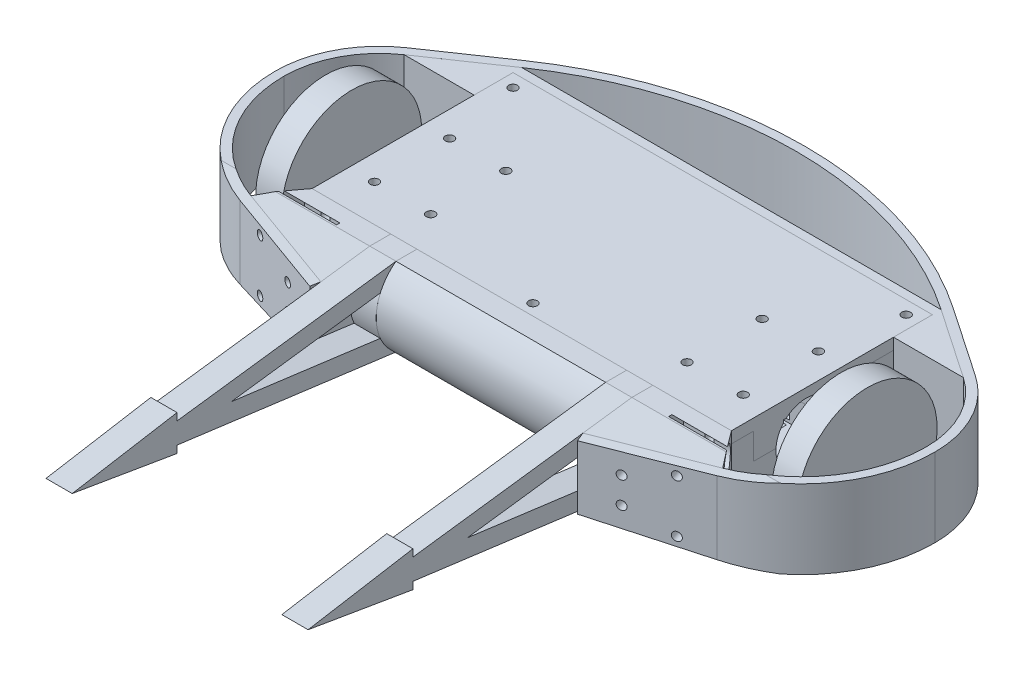
from build123d import *

# Parameters (mm, degrees)
BOSS_EXTRUDE1_DEPTH       = 76.2
BOSS_EXTRUDE1_DEPTH_BACK  = 76.2
SKETCH3_W                 = 76.2
SKETCH3_H                 = 28.575
SKETCH6_W                 = 16.51
SKETCH6_H                 = 16.51
CUT_EXTRUDE2_DEPTH        = 16.9164
SKETCH7_R                 = 10.9728
CUT_EXTRUDE3_DEPTH        = 4.0132
CUT_EXTRUDE4_START        = 2.54
SKETCH8_R                 = 10.9728
CUT_EXTRUDE4_DEPTH        = 2.54
CUT_EXTRUDE5_DEPTH        = 25.4
CUT_EXTRUDE6_START        = -33.8836
SKETCH10_W                = 19.05
SKETCH10_H                = 15.49908
CUT_EXTRUDE6_DEPTH        = 33.8836
SPLIT1_SURFACE_1_BACK     = 173.768
SPLIT1_SURFACE_1_DEPTH    = 347.536
SPLIT1_SURFACE_2_BACK     = 173.768
SPLIT1_SURFACE_2_DEPTH    = 347.536
CUT_EXTRUDE7_START        = 4.1275
CUT_EXTRUDE7_DEPTH        = 20.32
BOSS_EXTRUDE2_DEPTH       = 38.1
BOSS_EXTRUDE3_DEPTH       = 9.525
BOSS_EXTRUDE4_START       = 12.7
SKETCH16_R                = 25.4
BOSS_EXTRUDE4_DEPTH       = 9.525
BOSS_EXTRUDE5_DEPTH       = 28.575
BOSS_EXTRUDE6_DEPTH       = 28.575
BOSS_EXTRUDE7_DEPTH       = 28.575
CUT_EXTRUDE8_DEPTH        = 201.445311888
CUT_EXTRUDE8_DEPTH_BACK   = 201.445311888
CUT_EXTRUDE9_DEPTH        = 201.445311888
CUT_EXTRUDE9_DEPTH_BACK   = 201.445311888
SKETCH21_R                = 2.2225
CUT_EXTRUDE11_START       = 12.7
CUT_EXTRUDE11_OUTLINE_R   = 4.8006
CUT_EXTRUDE11_OUTLINE_R_2 = 2.2225
CUT_EXTRUDE11_DEPTH       = 25.4
SKETCH23_R                = 1.5748
CUT_EXTRUDE12_DEPTH       = 25.4
SKETCH24_R                = 2.2225
CUT_EXTRUDE13_DEPTH       = 12.7
SKETCH25_R                = 1.5748
CUT_EXTRUDE14_DEPTH       = 3.175
SKETCH26_R                = 2.2225
CUT_EXTRUDE15_DEPTH       = 3.175
SKETCH28_R                = 2.7051
CUT_EXTRUDE16_DEPTH       = 233.08902432
SKETCH29_R                = 1.5875
CUT_EXTRUDE17_DEPTH       = 25.4


with BuildPart() as part:
    # Sketch3 → Boss-Extrude1 (new, two sides: drawn at the far end of the back side and taken through both)
    with BuildSketch(Plane(origin=(0, 0, 0), x_dir=(0, 0, -1), z_dir=(1, 0, 0)).offset(-BOSS_EXTRUDE1_DEPTH_BACK)):
        with Locations((10.9728, 25.4)):
            Rectangle(SKETCH3_W, SKETCH3_H)
    extrude(amount=BOSS_EXTRUDE1_DEPTH + BOSS_EXTRUDE1_DEPTH_BACK)

    # Sketch6 → Cut-Extrude2 (cut)
    with BuildSketch(Plane(origin=(76.2, 0, 0), x_dir=(0, 0, -1), z_dir=(1, 0, 0))):
        with Locations((0, 25.4)):
            Rectangle(SKETCH6_W, SKETCH6_H)
    cut_extrude2 = extrude(amount=-CUT_EXTRUDE2_DEPTH, mode=Mode.SUBTRACT)

    # Sketch7 → Cut-Extrude3 (cut)
    with BuildSketch(Plane(origin=(76.2, 0, 0), x_dir=(0, 0, -1), z_dir=(1, 0, 0))):
        with Locations((0, 25.4)):
            Circle(SKETCH7_R)
    cut_extrude3 = extrude(amount=-CUT_EXTRUDE3_DEPTH, mode=Mode.SUBTRACT)

    # Sketch8 → Cut-Extrude4 (cut)
    with BuildSketch(Plane(origin=(59.2836, 0, 0), x_dir=(0, 0, -1), z_dir=(1, 0, 0)).offset(CUT_EXTRUDE4_START)):
        with Locations((0, 25.4)):
            Circle(SKETCH8_R)
    cut_extrude4 = extrude(amount=-CUT_EXTRUDE4_DEPTH, mode=Mode.SUBTRACT)

    # Sketch9 → Cut-Extrude5 (cut)
    with BuildSketch(Plane(origin=(59.2836, 0, 0), x_dir=(0, 0, -1), z_dir=(1, 0, 0))):
        with BuildLine():
            Line((7.74954, 32.033075169), (7.74954, 18.766924831))
            ThreePointArc((7.74954, 18.766924831), (0, 15.19936), (-7.74954, 18.766924831))
            Line((-7.74954, 18.766924831), (-7.74954, 32.033075169))
            ThreePointArc((-7.74954, 32.033075169), (0, 35.60064), (7.74954, 32.033075169))
        make_face()
    cut_extrude5 = extrude(amount=-CUT_EXTRUDE5_DEPTH, mode=Mode.SUBTRACT)

    # Sketch10 → Cut-Extrude6 (cut)
    with BuildSketch(Plane(origin=(33.8836, 0, 0), x_dir=(0, 0, -1), z_dir=(1, 0, 0)).offset(CUT_EXTRUDE6_START)):
        with Locations((0, 25.4)):
            Rectangle(SKETCH10_W, SKETCH10_H)
    cut_extrude6 = extrude(amount=CUT_EXTRUDE6_DEPTH, mode=Mode.SUBTRACT)

    # Mirror1: Cut-Extrude2, Cut-Extrude3, Cut-Extrude4, Cut-Extrude5, Cut-Extrude6 across plane
    add(cut_extrude2.mirror(Plane(origin=(0, 0, 0), x_dir=(0, 0, 1), z_dir=(1, 0, 0))), mode=Mode.SUBTRACT)
    add(cut_extrude3.mirror(Plane(origin=(0, 0, 0), x_dir=(0, 0, 1), z_dir=(1, 0, 0))), mode=Mode.SUBTRACT)
    add(cut_extrude4.mirror(Plane(origin=(0, 0, 0), x_dir=(0, 0, 1), z_dir=(1, 0, 0))), mode=Mode.SUBTRACT)
    add(cut_extrude5.mirror(Plane(origin=(0, 0, 0), x_dir=(0, 0, 1), z_dir=(1, 0, 0))), mode=Mode.SUBTRACT)
    add(cut_extrude6.mirror(Plane(origin=(0, 0, 0), x_dir=(0, 0, 1), z_dir=(1, 0, 0))), mode=Mode.SUBTRACT)


with BuildPart() as body_2:
    # Split1: the piece behind the surface
    add(part.part)
    # Split1 surface: a surface, the sketch's curves swept straight by 347.536 mm
    with BuildLine(Plane(origin=(0, 0, 0), x_dir=(0, 0, -1), z_dir=(1, 0, 0)).offset(-SPLIT1_SURFACE_1_BACK), mode=Mode.PRIVATE) as split1_surface_1_path:
        Line((-27.1272, 35.56), (-19.05, 35.56))
        Line((-19.05, 35.56), (-19.05, 26.035))
        Line((-19.05, 26.035), (0, 26.035))
        Line((0, 26.035), (19.05, 26.035))
        Line((19.05, 26.035), (19.05, 35.56))
        Line((19.05, 35.56), (45.8978, 35.56))
        Line((45.8978, 35.56), (45.8978, 39.6875))
    split1_surface_1 = Shell.extrude(split1_surface_1_path.wire(), (1 * SPLIT1_SURFACE_1_DEPTH, 0 * SPLIT1_SURFACE_1_DEPTH, 0 * SPLIT1_SURFACE_1_DEPTH))
    split(bisect_by=split1_surface_1, keep=Keep.BOTTOM)


with BuildPart() as part_1:
    add(part.part)

    # Split1: split by a surface, the side it looks to stays
    # Split1 surface: a surface, the sketch's curves swept straight by 347.536 mm
    with BuildLine(Plane(origin=(0, 0, 0), x_dir=(0, 0, -1), z_dir=(1, 0, 0)).offset(-SPLIT1_SURFACE_2_BACK), mode=Mode.PRIVATE) as split1_surface_2_path:
        Line((-27.1272, 35.56), (-19.05, 35.56))
        Line((-19.05, 35.56), (-19.05, 26.035))
        Line((-19.05, 26.035), (0, 26.035))
        Line((0, 26.035), (19.05, 26.035))
        Line((19.05, 26.035), (19.05, 35.56))
        Line((19.05, 35.56), (45.8978, 35.56))
        Line((45.8978, 35.56), (45.8978, 39.6875))
    split1_surface_2 = Shell.extrude(split1_surface_2_path.wire(), (1 * SPLIT1_SURFACE_2_DEPTH, 0 * SPLIT1_SURFACE_2_DEPTH, 0 * SPLIT1_SURFACE_2_DEPTH))
    split(bisect_by=split1_surface_2, keep=Keep.TOP)


with BuildPart() as cut_extrude7_tool:
    # Sketch13 → Cut-Extrude7 (new body)
    with BuildSketch(Plane(origin=(0, 11.1125, 0), x_dir=(1, 0, 0), z_dir=(0, 1, 0)).offset(CUT_EXTRUDE7_START)):
        Polygon((-66.675, 19.05), (-66.675, 45.8978), (66.675, 45.8978), (66.675, 19.05), (33.8836, 19.05), (33.8836, -19.05), (-33.8836, -19.05), (-33.8836, 19.05), align=None)
    extrude(amount=CUT_EXTRUDE7_DEPTH)


with BuildPart() as part_2:
    add(part_1.part)

    # Cut-Extrude7: cut by cut_extrude7_tool
    add(cut_extrude7_tool.part, mode=Mode.SUBTRACT)


with BuildPart() as body_2_1:
    add(body_2.part)

    # Cut-Extrude7: cut by cut_extrude7_tool
    add(cut_extrude7_tool.part, mode=Mode.SUBTRACT)

    # Sketch14 → Boss-Extrude2 (add, symmetric)
    with BuildSketch(Plane(origin=(0, 0, 0), x_dir=(0, 0, -1), z_dir=(1, 0, 0))):
        with BuildLine():
            Line((-27.1272, 11.1125), (-34.7472, 11.1125))
            ThreePointArc((-34.7472, 11.1125), (-41.944395847, 25.4), (-34.7472, 39.6875))
            Line((-34.7472, 39.6875), (-27.1272, 39.6875))
            Line((-27.1272, 39.6875), (-27.1272, 11.1125))
        make_face()
    extrude(amount=BOSS_EXTRUDE2_DEPTH, both=True)


with BuildPart() as body_3:
    # Sketch15 → Boss-Extrude3 (new body)
    with BuildSketch(Plane.ZY.offset(38.1)):
        Polygon((34.7472, 11.1125), (27.1272, 11.1125), (27.1272, 39.6875), (34.7472, 39.6875), (114.3, 29.21), (114.3, 31.840075421), (152.4, 25.4), (114.3, 18.959924579), (114.3, 21.59), align=None)
    extrude(amount=BOSS_EXTRUDE3_DEPTH)


with BuildPart() as body_4:
    # Sketch16 → Boss-Extrude4 (new body)
    with BuildSketch(Plane.ZY.offset(76.2).offset(BOSS_EXTRUDE4_START)):
        with Locations(Location((0, 25.4, 0), (0, 0, 180))):
            Circle(SKETCH16_R)
    extrude(amount=BOSS_EXTRUDE4_DEPTH)


with BuildPart() as body_5:
    # Sketch17 → Boss-Extrude5 (new body)
    with BuildSketch(Plane(origin=(0, 39.6875, 0), x_dir=(1, 0, 0), z_dir=(0, 1, 0))):
        Polygon((-76.2, 49.0728), (-101.6, 31.75), (-76.2, 31.75), align=None)
    extrude(amount=-BOSS_EXTRUDE5_DEPTH)


with BuildPart() as body_6:
    # Sketch18 → Boss-Extrude6 (new body)
    with BuildSketch(Plane(origin=(0, 39.6875, 0), x_dir=(1, 0, 0), z_dir=(0, 1, 0))):
        Polygon((-76.2, -27.1272), (-85.725, -39.8272), (-47.625, -52.5272), (-47.625, -27.1272), align=None)
    extrude(amount=-BOSS_EXTRUDE6_DEPTH)


with BuildPart() as body_7:
    # Sketch19 → Boss-Extrude7 (new body)
    with BuildSketch(Plane(origin=(0, 39.6875, 0), x_dir=(1, 0, 0), z_dir=(0, 1, 0))):
        with BuildLine():
            Line((-47.625, -52.5272), (-85.725, -39.8272))
            ThreePointArc((-85.725, -39.8272), (-108.154999782, -23.334922423), (-116.707955661, 3.159361029))
            ThreePointArc((-116.707955661, 3.159361029), (-112.698729515, 19.327809385), (-101.6, 31.75))
            Line((-101.6, 31.75), (-76.2, 49.0728))
            ThreePointArc((-76.2, 49.0728), (-39.872261336, 66.57216389), (0, 72.583412419))
            Line((0, 72.583412419), (0, 75.758412419))
            ThreePointArc((0, 75.758412419), (-40.808328065, 69.606039972), (-77.988919973, 51.695849814))
            Line((-77.988919973, 51.695849814), (-103.388919973, 34.373049814))
            ThreePointArc((-103.388919973, 34.373049814), (-115.505902997, 20.811184604), (-119.882955661, 3.159361029))
            ThreePointArc((-119.882955661, 3.159361029), (-110.73069372, -25.191377577), (-86.729023157, -42.839269471))
            Line((-86.729023157, -42.839269471), (-48.629023157, -55.539269471))
            Line((-48.629023157, -55.539269471), (-47.625, -52.5272))
        make_face()
    extrude(amount=-BOSS_EXTRUDE7_DEPTH)


with BuildPart() as cut_extrude8_tool:
    # Sketch20 → Cut-Extrude8 (new, two sides: drawn at the far end of the back side and taken through both)
    with BuildSketch(Plane(origin=(0, 0, 0), x_dir=(0, 0, -1), z_dir=(1, 0, 0)).offset(-CUT_EXTRUDE8_DEPTH_BACK)):
        Polygon((-114.3, 29.21), (-114.3, 39.6875), (-34.7472, 39.6875), align=None)
        Polygon((-114.3, 21.59), (-114.3, 11.1125), (-34.7472, 11.1125), align=None)
    extrude(amount=CUT_EXTRUDE8_DEPTH + CUT_EXTRUDE8_DEPTH_BACK)


with BuildPart() as body_6_1:
    add(body_6.part)

    # Cut-Extrude8: cut by cut_extrude8_tool
    add(cut_extrude8_tool.part, mode=Mode.SUBTRACT)


with BuildPart() as body_7_1:
    add(body_7.part)

    # Cut-Extrude8: cut by cut_extrude8_tool
    add(cut_extrude8_tool.part, mode=Mode.SUBTRACT)


with BuildPart() as body_8:
    # Mirror21: mirrored copy
    add(body_7_1.part.mirror(Plane(origin=(0, 0, 0), x_dir=(0, 0, 1), z_dir=(1, 0, 0))))


with BuildPart() as body_9:
    # Mirror21 2: mirrored copy
    add(body_5.part.mirror(Plane(origin=(0, 0, 0), x_dir=(0, 0, 1), z_dir=(1, 0, 0))))


with BuildPart() as body_10:
    # Mirror21 3: mirrored copy
    add(body_4.part.mirror(Plane(origin=(0, 0, 0), x_dir=(0, 0, 1), z_dir=(1, 0, 0))))


with BuildPart() as body_11:
    # Mirror21 4: mirrored copy
    add(body_6_1.part.mirror(Plane(origin=(0, 0, 0), x_dir=(0, 0, 1), z_dir=(1, 0, 0))))


with BuildPart() as body_12:
    # Mirror21 5: mirrored copy
    add(body_3.part.mirror(Plane(origin=(0, 0, 0), x_dir=(0, 0, 1), z_dir=(1, 0, 0))))


with BuildPart() as body_5_1:
    add(body_5.part)

    # Combine2: union body 6, body 11, body 9, body 2
    add(body_6_1.part)
    add(body_11.part)
    add(body_9.part)
    add(body_2_1.part)


with BuildPart() as body_7_2:
    add(body_7_1.part)

    # Combine3: union body 8
    add(body_8.part)

    # Sketch25 → Cut-Extrude14 (cut)
    with BuildSketch(Plane(origin=(-21.524683157, 0, 64.574049471), x_dir=(0.948683298050514, 0, 0.3162277660168375), z_dir=(-0.3162277660168375, 0, 0.948683298050514))):
        with Locations((-41.270482959, 20.6375)):
            Circle(SKETCH25_R)
        with Locations((-57.145482959, 15.875)):
            Circle(SKETCH25_R)
        with Locations((-57.145482959, 34.925)):
            Circle(SKETCH25_R)
        with Locations((-41.270482959, 30.1625)):
            Circle(SKETCH25_R)
    cut_extrude14 = extrude(amount=-CUT_EXTRUDE14_DEPTH, mode=Mode.SUBTRACT)

    # Sketch26 → Cut-Extrude15 (cut)
    with BuildSketch(Plane(origin=(-48.822548799, 0, -71.587314955), x_dir=(-0.8261574218530331, 0, 0.563439361703768), z_dir=(-0.563439361703768, 0, -0.8261574218530331))):
        with Locations((44.828648436, 35.56)):
            Circle(SKETCH26_R)
        with Locations((44.828648436, 15.24)):
            Circle(SKETCH26_R)
    cut_extrude15 = extrude(amount=-CUT_EXTRUDE15_DEPTH, mode=Mode.SUBTRACT)

    # Mirror27: Cut-Extrude14, Cut-Extrude15 across plane
    add(cut_extrude14.mirror(Plane(origin=(0, 0, 0), x_dir=(0, 0, 1), z_dir=(1, 0, 0))), mode=Mode.SUBTRACT)
    add(cut_extrude15.mirror(Plane(origin=(0, 0, 0), x_dir=(0, 0, 1), z_dir=(1, 0, 0))), mode=Mode.SUBTRACT)


with BuildPart() as cut_extrude9_tool:
    # Sketch21 → Cut-Extrude9 (new, two sides: drawn at the far end of the back side and taken through both)
    with BuildSketch(Plane(origin=(0, 0, 0), x_dir=(0, 0, -1), z_dir=(1, 0, 0)).offset(-CUT_EXTRUDE9_DEPTH_BACK)):
        with Locations((-37.143795847, 25.4)):
            Circle(SKETCH21_R)
        with Locations((-33.4772, 34.925)):
            Circle(SKETCH21_R)
        with Locations((-33.4772, 15.875)):
            Circle(SKETCH21_R)
    extrude(amount=CUT_EXTRUDE9_DEPTH + CUT_EXTRUDE9_DEPTH_BACK)


with BuildPart() as body_3_1:
    add(body_3.part)

    # Cut-Extrude9: cut by cut_extrude9_tool
    add(cut_extrude9_tool.part, mode=Mode.SUBTRACT)


with BuildPart() as body_5_2:
    add(body_5_1.part)

    # Cut-Extrude9: cut by cut_extrude9_tool
    add(cut_extrude9_tool.part, mode=Mode.SUBTRACT)

    # Cut-Extrude11: read off the stored shape, not the designer's step
    # Cut-Extrude11 outline → Cut-Extrude11 (cut)
    # profile 1 of 3: a face of its own
    with BuildSketch(Plane.ZY.offset(47.625).offset(CUT_EXTRUDE11_START)):
        with Locations((37.143795847, 25.4)):
            Circle(CUT_EXTRUDE11_OUTLINE_R)
        with Locations((37.143795847, 25.4)):
            Circle(CUT_EXTRUDE11_OUTLINE_R_2, mode=Mode.SUBTRACT)
    # profile 2 of 3: a face of its own
    with BuildSketch(Plane.ZY.offset(47.625).offset(CUT_EXTRUDE11_START)):
        with BuildLine():
            ThreePointArc((32.87358248, 39.6875), (33.4772, 30.1244), (34.08081752, 39.6875))
            Line((34.08081752, 39.6875), (32.87358248, 39.6875))
        make_face()
        with Locations((33.4772, 34.925)):
            Circle(CUT_EXTRUDE11_OUTLINE_R_2, mode=Mode.SUBTRACT)
    # profile 3 of 3: a face of its own
    with BuildSketch(Plane.ZY.offset(47.625).offset(CUT_EXTRUDE11_START)):
        with BuildLine():
            ThreePointArc((34.08081752, 11.1125), (33.4772, 20.6756), (32.87358248, 11.1125))
            Line((32.87358248, 11.1125), (34.08081752, 11.1125))
        make_face()
        with Locations((33.4772, 15.875)):
            Circle(CUT_EXTRUDE11_OUTLINE_R_2, mode=Mode.SUBTRACT)
    cut_extrude11 = extrude(amount=CUT_EXTRUDE11_DEPTH, mode=Mode.SUBTRACT)

    # Sketch23 → Cut-Extrude12 (cut)
    with BuildSketch(Plane(origin=(-20.52066, 0, 61.56198), x_dir=(0.9486832980505138, 0, 0.31622776601683805), z_dir=(-0.31622776601683805, 0, 0.9486832980505138))):
        with Locations((-57.145482959, 34.925)):
            Circle(SKETCH23_R)
        with Locations((-41.270482959, 30.1625)):
            Circle(SKETCH23_R)
        with Locations((-41.270482959, 20.6375)):
            Circle(SKETCH23_R)
        with Locations((-57.145482959, 15.875)):
            Circle(SKETCH23_R)
    cut_extrude12 = extrude(amount=-CUT_EXTRUDE12_DEPTH, mode=Mode.SUBTRACT)

    # Sketch24 → Cut-Extrude13 (cut)
    with BuildSketch(Plane(origin=(-47.033628826, 0, -68.964265141), x_dir=(-0.8261574218530332, 0, 0.5634393617037681), z_dir=(-0.5634393617037681, 0, -0.8261574218530332))):
        with Locations((44.828648436, 35.56)):
            Circle(SKETCH24_R)
        with Locations((44.828648436, 15.24)):
            Circle(SKETCH24_R)
    cut_extrude13 = extrude(amount=-CUT_EXTRUDE13_DEPTH, mode=Mode.SUBTRACT)

    # Mirror26: Cut-Extrude11, Cut-Extrude12, Cut-Extrude13 across plane
    add(cut_extrude11.mirror(Plane(origin=(0, 0, 0), x_dir=(0, 0, 1), z_dir=(1, 0, 0))), mode=Mode.SUBTRACT)
    add(cut_extrude12.mirror(Plane(origin=(0, 0, 0), x_dir=(0, 0, 1), z_dir=(1, 0, 0))), mode=Mode.SUBTRACT)
    add(cut_extrude13.mirror(Plane(origin=(0, 0, 0), x_dir=(0, 0, 1), z_dir=(1, 0, 0))), mode=Mode.SUBTRACT)


with BuildPart() as cut_extrude16_tool:
    # Sketch28 → Cut-Extrude16 (new, through all)
    with BuildSketch(Plane.ZY.offset(47.625)):
        with Locations((33.4772, 34.925)):
            Circle(SKETCH28_R)
        with Locations((37.143795847, 25.4)):
            Circle(SKETCH28_R)
        with Locations((33.4772, 15.875)):
            Circle(SKETCH28_R)
        with BuildLine():
            Line((40.451568022, 32.53136891), (94.59810724, 25.4))
            Line((94.59810724, 25.4), (40.451568022, 18.26863109))
            ThreePointArc((40.451568022, 18.26863109), (41.944395847, 25.4), (40.451568022, 32.53136891))
        make_face()
    extrude(amount=-CUT_EXTRUDE16_DEPTH)


with BuildPart() as body_3_2:
    add(body_3_1.part)

    # Cut-Extrude16: cut by cut_extrude16_tool
    add(cut_extrude16_tool.part, mode=Mode.SUBTRACT)


with BuildPart() as body_12_1:
    add(body_12.part)

    # Cut-Extrude16: cut by cut_extrude16_tool
    add(cut_extrude16_tool.part, mode=Mode.SUBTRACT)


with BuildPart() as cut_extrude17_tool:
    # Sketch29 → Cut-Extrude17 (new body)
    with BuildSketch(Plane(origin=(0, 39.6875, 0), x_dir=(1, 0, 0), z_dir=(0, 1, 0))):
        with Locations(Location((-67.0052, 13.6525, 0), (0, 0, 270))):
            Circle(SKETCH29_R)
        with Locations(Location((-46.5836, 13.6525, 0), (0, 0, 270))):
            Circle(SKETCH29_R)
        with Locations(Location((-67.0052, -13.6525, 0), (0, 0, 270))):
            Circle(SKETCH29_R)
        with Locations(Location((-46.5836, -13.6525, 0), (0, 0, 270))):
            Circle(SKETCH29_R)
        with Locations(Location((-71.4375, 41.1353, 0), (0, 0, 270))):
            Circle(SKETCH29_R)
        with Locations(Location((0, -23.0886, 0), (0, 0, 270))):
            Circle(SKETCH29_R)
        with Locations(Location((71.4375, 41.1353, 0), (0, 0, 90))):
            Circle(SKETCH29_R)
        with Locations(Location((46.5836, 13.6525, 0), (0, 0, 90))):
            Circle(SKETCH29_R)
        with Locations(Location((67.0052, 13.6525, 0), (0, 0, 90))):
            Circle(SKETCH29_R)
        with Locations(Location((67.0052, -13.6525, 0), (0, 0, 90))):
            Circle(SKETCH29_R)
        with Locations(Location((46.5836, -13.6525, 0), (0, 0, 90))):
            Circle(SKETCH29_R)
    extrude(amount=-CUT_EXTRUDE17_DEPTH)


with BuildPart() as part_3:
    add(part_2.part)

    # Cut-Extrude17: cut by cut_extrude17_tool
    add(cut_extrude17_tool.part, mode=Mode.SUBTRACT)


with BuildPart() as body_5_3:
    add(body_5_2.part)

    # Cut-Extrude17: cut by cut_extrude17_tool
    add(cut_extrude17_tool.part, mode=Mode.SUBTRACT)


solid = Compound([body_4.part, body_10.part, body_7_2.part, body_3_2.part, body_12_1.part, part_3.part, body_5_3.part])
